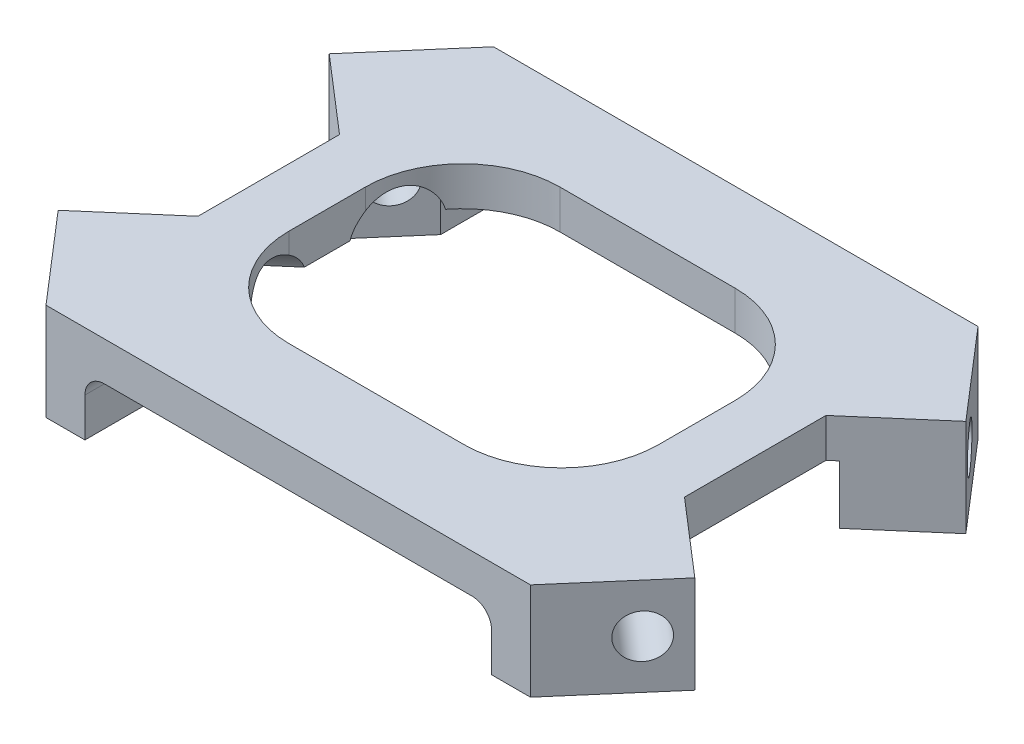
from build123d import *

# Parameters (mm, degrees)
BOSS_EXTRUDE1_DEPTH = 4
BOSS_EXTRUDE2_DEPTH = 6
SKETCH4_R           = 2.25
CUT_EXTRUDE1_DEPTH  = 36.318797722
CUT_EXTRUDE2_REACH  = 28.63
SKETCH5_R           = 3.75
FILLET1_R           = 10
FILLET3_R           = 2


with BuildPart() as part:
    # Sketch2 → Boss-Extrude1 (new body)
    with BuildSketch(Plane(origin=(0, 0, 0), x_dir=(1, 0, 0), z_dir=(0, 1, 0))):
        Polygon((-32.718226242, 13.928959815), (-24.894958744, 23), (0, 23), (0, 13.928959815), (-19, 13.928959815), (-19, 0), (-25, 0), (-25, 7.27241908), align=None)
    extrude(amount=-BOSS_EXTRUDE1_DEPTH)

    # Sketch3 → Boss-Extrude2 (add)
    with BuildSketch(Plane(origin=(0, -4, 0), x_dir=(-1, 0, 0), z_dir=(0, 1, 0))):
        Polygon((25.757269356, -7.92552177), (32.718226242, -13.928959815), (24.894958744, -23), (20.894958744, -23), (20.894958744, -13.563347009), align=None)
    extrude(amount=-BOSS_EXTRUDE2_DEPTH)

    # Sketch4 → Cut-Extrude1 (cut, through all)
    with BuildSketch(Plane(origin=(-25.651402317, 0, -22.122907398), x_dir=(-0.653102689208867, 0, 0.7572693558755339), z_dir=(-0.7572693558755339, 0, -0.653102689208867))):
        with Locations((7.020387118, -5)):
            Circle(SKETCH4_R)
    extrude(amount=-CUT_EXTRUDE1_DEPTH, mode=Mode.SUBTRACT)

    # Sketch5 → Cut-Extrude2 (cut, up to next)
    with BuildSketch(Plane(origin=(-18.690445431, 0, -16.119469352), x_dir=(0.6531026892088669, 0, -0.757269355875534), z_dir=(0.757269355875534, 0, 0.6531026892088669)), mode=Mode.PRIVATE) as cut_extrude2_sk1:
        with Locations((-7.020387118, -5)):
            Circle(SKETCH5_R)
    cut_extrude2_tool1 = extrude(cut_extrude2_sk1.sketch, amount=CUT_EXTRUDE2_REACH, mode=Mode.PRIVATE) & part.part
    add(cut_extrude2_tool1.solids().sort_by_distance((-23.275479, -5, -10.803145))[0], mode=Mode.SUBTRACT)

    # Fillet1
    fillet1_edges = [part.edges().sort_by_distance(p)[0] for p in [
        (-19, -2, -13.928959815),
    ]]
    fillet(fillet1_edges, radius=FILLET1_R)

    # Fillet3
    fillet3_edges = [part.edges().sort_by_distance(p)[0] for p in [
        (-20.894958744, -4, -18.281673505),
    ]]
    fillet(fillet3_edges, radius=FILLET3_R)

    # Mirror1: part across plane


with BuildPart() as part_1:
    add(part.part)
    add(part.part.mirror(Plane.XY))

    # Mirror2: part across plane


with BuildPart() as part_2:
    add(part_1.part)
    add(part_1.part.mirror(Plane(origin=(0, 0, 0), x_dir=(0, 0, 1), z_dir=(1, 0, 0))))


solid = part_2.part
